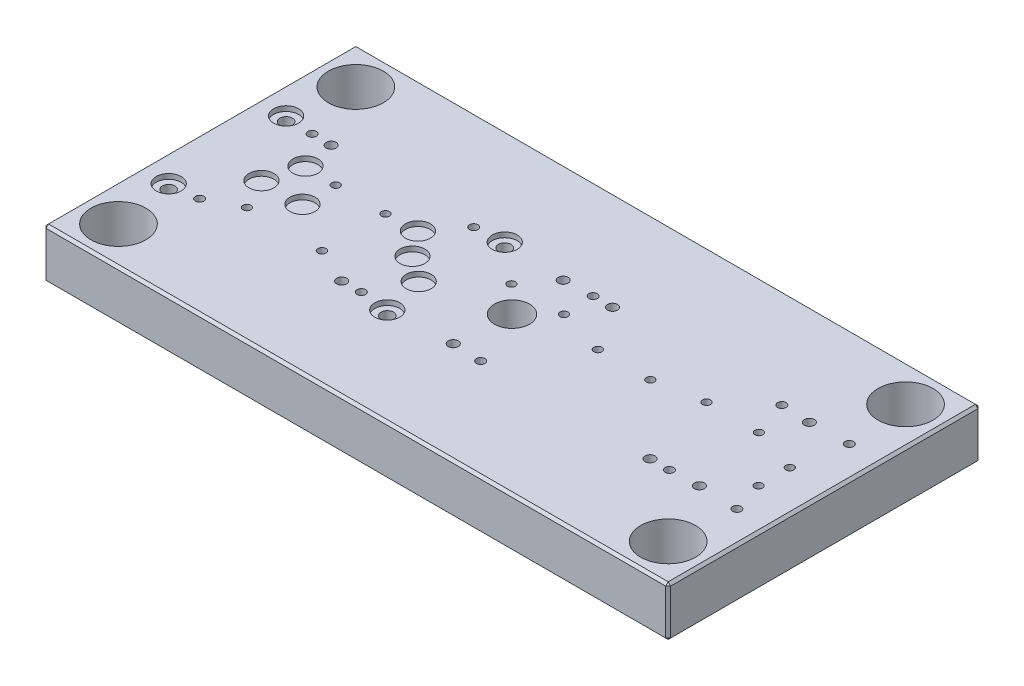
from build123d import *

# Parameters (mm, degrees)
SKETCH2_W                                           = 500
SKETCH2_H                                           = 125
BOSS_EXTRUDE1_DEPTH                                 = 40
SKETCH3_W                                           = 500
SKETCH3_H                                           = 40
BOSS_EXTRUDE2_DEPTH                                 = 125
SKETCH6_R                                           = 22
CUT_EXTRUDE1_DEPTH                                  = 316.04959927
M30X2_0_TAPPED_HOLE1_D                              = 28
CHAMFER1_SIZE                                       = 2
M8_TAPPED_HOLE1_D                                   = 6.8
F_8_0MM_DOWEL_HOLE1_D                               = 8
CBORE_FOR_M6_HEX_SOCKET_HEAD_CAP_SCREW1_D           = 6.4
CBORE_FOR_M6_HEX_SOCKET_HEAD_CAP_SCREW1_CBORE_D     = 11
CBORE_FOR_M6_HEX_SOCKET_HEAD_CAP_SCREW1_CBORE_DEPTH = 6.4
CBORE_FOR_M6_HEX_SOCKET_HEAD_CAP_SCREW2_D           = 6.4
CBORE_FOR_M6_HEX_SOCKET_HEAD_CAP_SCREW2_CBORE_D     = 11
CBORE_FOR_M6_HEX_SOCKET_HEAD_CAP_SCREW2_CBORE_DEPTH = 6.4
SKETCH25_R                                          = 10
CUT_EXTRUDE2_DEPTH                                  = 4
F_10_0_10_DIAMETER_HOLE1_D                          = 10
SKETCH35_R                                          = 8.5
CUT_EXTRUDE3_DEPTH                                  = 24
F_8_0_8_DIAMETER_HOLE2_D                            = 8
SKETCH43_R                                          = 7
CUT_EXTRUDE4_DEPTH                                  = 32
M8_TAPPED_HOLE2_D                                   = 6.8


with BuildPart() as part:
    # Sketch2 → Boss-Extrude1 (new body)
    with BuildSketch(Plane(origin=(0, 0, 0), x_dir=(1, 0, 0), z_dir=(0, 1, 0))):
        Rectangle(SKETCH2_W, SKETCH2_H)
    extrude(amount=BOSS_EXTRUDE1_DEPTH)

    # Sketch3 → Boss-Extrude2 (add)
    with BuildSketch(Plane(origin=(0, 0, -62.5), x_dir=(-1, 0, 0), z_dir=(0, 0, -1))):
        with Locations((0, 20)):
            Rectangle(SKETCH3_W, SKETCH3_H)
    extrude(amount=BOSS_EXTRUDE2_DEPTH)

    # Sketch6 → Cut-Extrude1 (cut, through all)
    with BuildSketch(Plane(origin=(0, 0, 0), x_dir=(-1, 0, 0), z_dir=(0, -1, 0))):
        with Locations((-220, 157.5)):
            Circle(SKETCH6_R)
        with Locations((-220, -32.5)):
            Circle(SKETCH6_R)
    cut_extrude1 = extrude(amount=-CUT_EXTRUDE1_DEPTH, mode=Mode.SUBTRACT)

    # Mirror1: Cut-Extrude1 across plane
    add(cut_extrude1.mirror(Plane(origin=(0, 0, 0), x_dir=(0, 0, 1), z_dir=(1, 0, 0))), mode=Mode.SUBTRACT)

    # M30x2.0 Tapped Hole1 (through all)
    with Locations(Plane(origin=(0, 40, 0), x_dir=(1, 0, 0), z_dir=(0, 1, 0))):
        with Locations((0, 62.5)):
            Hole(M30X2_0_TAPPED_HOLE1_D / 2)

    # Chamfer1
    chamfer1_edges = [part.edges().sort_by_distance(p)[0] for p in [
        (250, 40, -62.5),
        (250, 0, -62.5),
        (0, 40, -187.5),
        (250, 20, -187.5),
        (0, 0, -187.5),
        (-250, 40, -62.5),
        (-250, 20, -187.5),
        (-250, 0, -62.5),
        (250, 20, 62.5),
        (0, 40, 62.5),
        (-250, 20, 62.5),
        (0, 0, 62.5),
    ]]
    chamfer(chamfer1_edges, length=CHAMFER1_SIZE)

    # M8 Tapped Hole1 (through all)
    with Locations(Plane(origin=(0, 0, 0), x_dir=(-1, 0, 0), z_dir=(0, -1, 0))):
        with Locations((-171, 17.5), (-19.969, 17.5), (-19.969, 107.5), (-171, 107.5), (75.632503002, 107.5), (205, 107.5), (205, 17.5), (75.632503002, 17.5)):
            Hole(M8_TAPPED_HOLE1_D / 2)

    # Ø8.0mm Dowel Hole1 (through all)
    with Locations(Plane(origin=(0, 0, 0), x_dir=(-1, 0, 0), z_dir=(0, -1, 0))):
        with Locations((-155.5, 17.5), (-35.469, 107.5), (91.132503002, 17.258975019), (189.5, 107.228378806)):
            Hole(F_8_0MM_DOWEL_HOLE1_D / 2)

    # CBORE for M6 Hex Socket Head Cap Screw1 (through all)
    with Locations(Plane(origin=(0, 0, 0), x_dir=(-1, 0, 0), z_dir=(0, -1, 0))):
        with Locations((-180.875, 79.28), (-100.875, 72.352366083), (-58.875, 72.352366083), (-20.875, 83.19101), (-138.875, 79.28), (21.125, 83.19101), (-217.6, 42.28), (-217.6, 67.28)):
            CounterBoreHole(CBORE_FOR_M6_HEX_SOCKET_HEAD_CAP_SCREW1_D / 2, CBORE_FOR_M6_HEX_SOCKET_HEAD_CAP_SCREW1_CBORE_D / 2, CBORE_FOR_M6_HEX_SOCKET_HEAD_CAP_SCREW1_CBORE_DEPTH)

    # CBORE for M6 Hex Socket Head Cap Screw2 (through all)
    with Locations(Plane(origin=(0, 0, 0), x_dir=(-1, 0, 0), z_dir=(0, -1, 0))):
        with Locations((160, 81.36), (120.125, 81.36), (120, 30.34), (180, 30.34)):
            CounterBoreHole(CBORE_FOR_M6_HEX_SOCKET_HEAD_CAP_SCREW2_D / 2, CBORE_FOR_M6_HEX_SOCKET_HEAD_CAP_SCREW2_CBORE_D / 2, CBORE_FOR_M6_HEX_SOCKET_HEAD_CAP_SCREW2_CBORE_DEPTH)

    # Sketch25 → Cut-Extrude2 (cut)
    with BuildSketch(Plane(origin=(0, 40, 0), x_dir=(1, 0, 0), z_dir=(0, 1, 0))):
        with Locations((-227.816251501, 15.5)):
            Circle(SKETCH25_R)
        with Locations((-52.816251501, 15.5)):
            Circle(SKETCH25_R)
        with Locations((-52.816251501, 109.5)):
            Circle(SKETCH25_R)
        with Locations((-227.816251501, 109.5)):
            Circle(SKETCH25_R)
        with Locations((-185.316251501, 82.5)):
            Circle(SKETCH25_R)
        with Locations((-192.816251501, 54.78)):
            Circle(SKETCH25_R)
        with Locations((-160, 54.78)):
            Circle(SKETCH25_R)
        with Locations((-95.316251501, 82.5)):
            Circle(SKETCH25_R)
        with Locations((-80, 62.78)):
            Circle(SKETCH25_R)
        with Locations((-60, 47.78)):
            Circle(SKETCH25_R)
    extrude(amount=-CUT_EXTRUDE2_DEPTH, mode=Mode.SUBTRACT)

    # Ø10.0 (10) Diameter Hole1 (through all)
    with Locations(Plane(origin=(0, 40, 0), x_dir=(1, 0, 0), z_dir=(0, 1, 0))):
        with Locations((-52.816251501, 15.5), (-227.816251501, 109.5), (-227.816251501, 15.5), (-52.816251501, 109.5)):
            Hole(F_10_0_10_DIAMETER_HOLE1_D / 2)

    # Sketch35 → Cut-Extrude3 (cut)
    with BuildSketch(Plane.XZ):
        with Locations((-52.816251501, -109.5)):
            Circle(SKETCH35_R)
        with Locations((-227.816251501, -15.5)):
            Circle(SKETCH35_R)
        with Locations((-227.816251501, -109.5)):
            Circle(SKETCH35_R)
        with Locations((-52.816251501, -15.5)):
            Circle(SKETCH35_R)
    extrude(amount=-CUT_EXTRUDE3_DEPTH, mode=Mode.SUBTRACT)

    # Ø8.0 (8) Diameter Hole2 (through all)
    with Locations(Plane(origin=(0, 40, 0), x_dir=(1, 0, 0), z_dir=(0, 1, 0))):
        with Locations((-3.031, 106.5), (-3.031, 18.5), (194, 106.5), (194, 18.5)):
            Hole(F_8_0_8_DIAMETER_HOLE2_D / 2)

    # Sketch43 → Cut-Extrude4 (cut)
    with BuildSketch(Plane.XZ):
        with Locations((194, -106.5)):
            Circle(SKETCH43_R)
        with Locations((194, -18.5)):
            Circle(SKETCH43_R)
        with Locations((-3.031, -18.5)):
            Circle(SKETCH43_R)
        with Locations((-3.031, -106.5)):
            Circle(SKETCH43_R)
    extrude(amount=-CUT_EXTRUDE4_DEPTH, mode=Mode.SUBTRACT)

    # M8 Tapped Hole2 (through all)
    with Locations(Plane(origin=(0, 0, 0), x_dir=(-1, 0, 0), z_dir=(0, -1, 0))):
        with Locations((-225, 107.5), (-225, 17.5)):
            Hole(M8_TAPPED_HOLE2_D / 2)


solid = part.part
